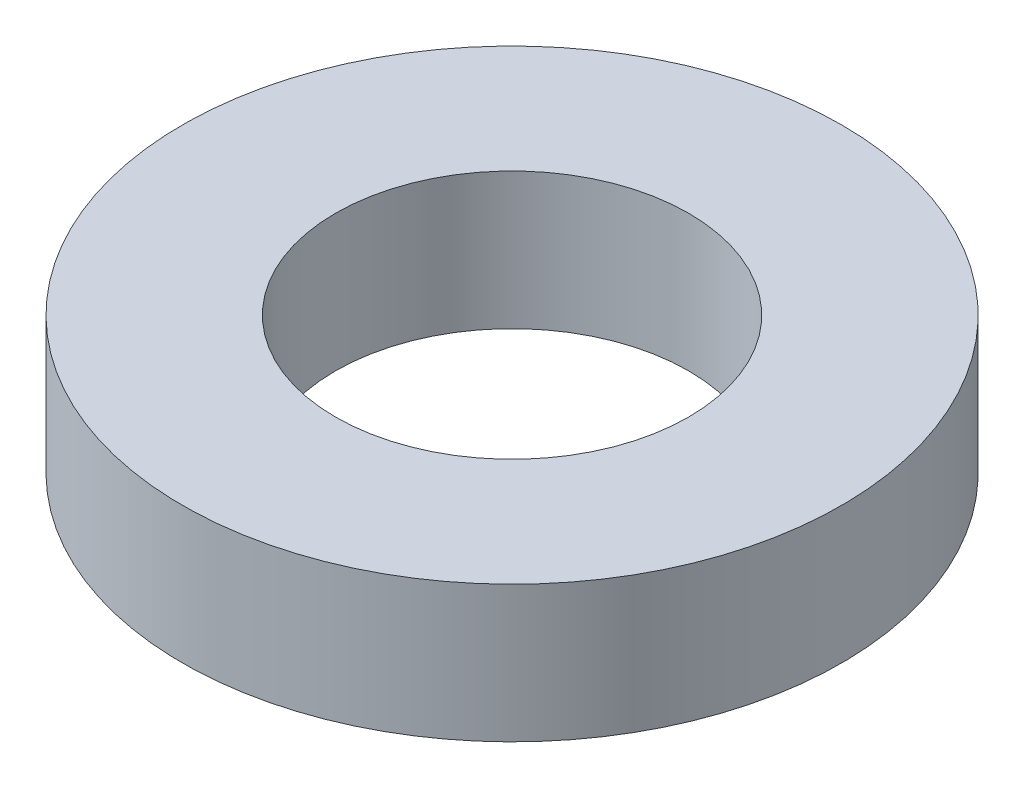
from build123d import *

# Parameters (mm, degrees)
SKETCH1_R           = 70
BOSS_EXTRUDE1_DEPTH = 29
SKETCH2_R           = 37.5
CUT_EXTRUDE1_DEPTH  = 104.155222844


with BuildPart() as part:
    # Sketch1 → Boss-Extrude1 (new body)
    with BuildSketch(Plane(origin=(0, 0, 0), x_dir=(1, 0, 0), z_dir=(0, 1, 0))):
        Circle(SKETCH1_R)
    extrude(amount=BOSS_EXTRUDE1_DEPTH)

    # Sketch2 → Cut-Extrude1 (cut, through all)
    with BuildSketch(Plane(origin=(0, 0, 0), x_dir=(1, 0, 0), z_dir=(0, 1, 0))):
        Circle(SKETCH2_R)
    extrude(amount=CUT_EXTRUDE1_DEPTH, mode=Mode.SUBTRACT)


solid = part.part
